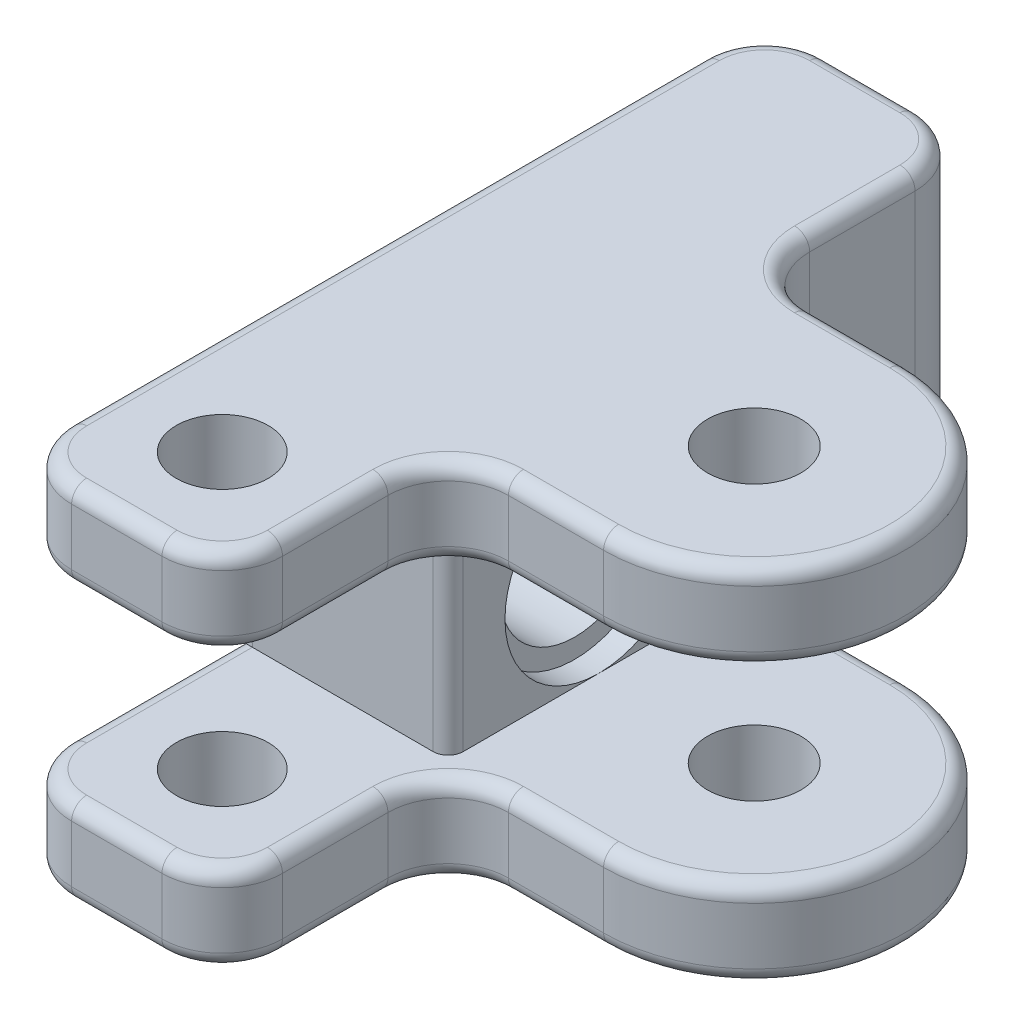
from build123d import *

# Parameters (mm, degrees)
SKETCH2_R           = 1.55
SKETCH2_R_2         = 1.525
BOSS_EXTRUDE1_DEPTH = 12
SKETCH3_W           = 11.91431853
SKETCH3_H           = 6.23
CUT_EXTRUDE1_DEPTH  = 12
FILLET2_R           = 2
SKETCH5_R           = 2.475
CUT_EXTRUDE3_DEPTH  = 13
SKETCH6_W           = 7
SKETCH6_H           = 6.23
CUT_EXTRUDE4_DEPTH  = 7.5
FILLET3_R           = 2
CUT_EXTRUDE5_START  = -0.8
SKETCH8_R           = 3.115
SKETCH8_R_2         = 2.475
CUT_EXTRUDE5_DEPTH  = 0.8
FILLET8_R           = 0.5


with BuildPart() as part:
    # Sketch2 → Boss-Extrude1 (new body)
    with BuildSketch(Plane(origin=(0, 0, 0), x_dir=(1, 0, 0), z_dir=(0, 1, 0))):
        with BuildLine():
            Line((-5.16, -5), (-5.16, -12.5))
            Line((-5.16, -12.5), (-12.16, -12.5))
            Line((-12.16, -12.5), (-12.16, 12.5))
            Line((-12.16, 12.5), (-5.16, 12.5))
            Line((-5.16, 12.5), (-5.16, 5))
            Line((-5.16, 5), (0, 5))
            ThreePointArc((0, 5), (5, 0), (0, -5))
            Line((0, -5), (-5.16, -5))
        make_face()
        with Locations(Location((0, 0, 0), (0, 0, 270))):
            Circle(SKETCH2_R, mode=Mode.SUBTRACT)
        with Locations(Location((-8.66, -9, 0), (0, 0, 270))):
            Circle(SKETCH2_R_2, mode=Mode.SUBTRACT)
    extrude(amount=BOSS_EXTRUDE1_DEPTH)

    # Sketch3 → Cut-Extrude1 (cut)
    with BuildSketch(Plane.XY.offset(5)):
        with Locations((0.797159265, 6)):
            Rectangle(SKETCH3_W, SKETCH3_H)
    extrude(amount=-CUT_EXTRUDE1_DEPTH, mode=Mode.SUBTRACT)

    # Fillet2
    fillet2_edges = [part.edges().sort_by_distance(p)[0] for p in [
        (-5.16, 10.5575, 5),
        (-5.16, 10.5575, -5),
        (-5.16, 1.4425, 5),
        (-5.16, 1.4425, -5),
    ]]
    fillet(fillet2_edges, radius=FILLET2_R)

    # Sketch5 → Cut-Extrude3 (cut)
    with BuildSketch(Plane.ZY.offset(12.16)):
        with Locations((0, 6)):
            Circle(SKETCH5_R)
    extrude(amount=-CUT_EXTRUDE3_DEPTH, mode=Mode.SUBTRACT)

    # Sketch6 → Cut-Extrude4 (cut)
    with BuildSketch(Plane.XY.offset(12.5)):
        with Locations((-8.66, 6)):
            Rectangle(SKETCH6_W, SKETCH6_H)
    extrude(amount=-CUT_EXTRUDE4_DEPTH, mode=Mode.SUBTRACT)

    # Fillet3
    fillet3_edges = [part.edges().sort_by_distance(p)[0] for p in [
        (-5.16, 1.4425, 12.5),
        (-12.16, 1.4425, 12.5),
        (-5.16, 10.5575, 12.5),
        (-12.16, 10.5575, 12.5),
        (-12.16, 6, -12.5),
        (-5.16, 6, -12.5),
    ]]
    fillet(fillet3_edges, radius=FILLET3_R)

    # Sketch8 → Cut-Extrude5 (cut)
    with BuildSketch(Plane(origin=(-5.16, 0, 0), x_dir=(0, 0, -1), z_dir=(1, 0, 0)).offset(CUT_EXTRUDE5_START)):
        with Locations((0, 6)):
            Circle(SKETCH8_R)
        with Locations(Location((0, 6, 0), (0, 0, 180))):
            Circle(SKETCH8_R_2, mode=Mode.SUBTRACT)
    extrude(amount=CUT_EXTRUDE5_DEPTH, mode=Mode.SUBTRACT)

    # Fillet8
    # the kernel refuses this fillet: 0.5 mm, written as the material it takes off along each edge
    with BuildSketch(Plane(origin=(-3.16, 0, -5), x_dir=(0, 0, 1), z_dir=(1, 0, 0)), Plane(origin=(-3.16, 2.885, -5), x_dir=(0, -1, 0), z_dir=(1, 0, 0)), Plane(origin=(0, 2.885, 5), x_dir=(0, -1, 0), z_dir=(-1, 0, 0)), Plane(origin=(0, 0, 5), x_dir=(0, 0, -1), z_dir=(-1, 0, 0))) as fillet8_piece_1:
        with BuildLine():
            CenterArc((FILLET8_R, -FILLET8_R), FILLET8_R, 90, 90)
            Line((0, -FILLET8_R), (0, 0))
            Line((0, 0), (FILLET8_R, 0))
        make_face()
    extrude(amount=3.16, mode=Mode.SUBTRACT)
    with BuildSketch(Plane(origin=(0, 0, 0), x_dir=(0, 0, -1), z_dir=(-1, 0, 0))) as fillet8_piece_2:
        with BuildLine():
            CenterArc((5 - FILLET8_R, -FILLET8_R), FILLET8_R, 0, 90)
            Line((5, -FILLET8_R), (5, 0))
            Line((5, 0), (5 - FILLET8_R, 0))
        make_face()
    revolve(axis=Axis((0, 0, 0), (0, -1, 0)), revolution_arc=180, mode=Mode.SUBTRACT)
    with BuildSketch(Plane(origin=(-12.16, 2.885, 5), x_dir=(0, 0, -1), z_dir=(0, 1, 0))) as fillet8_piece_3:
        with BuildLine():
            CenterArc((FILLET8_R, -FILLET8_R), FILLET8_R, 90, 90)
            Line((0, -FILLET8_R), (0, 0))
            Line((0, 0), (FILLET8_R, 0))
        make_face()
    extrude(amount=6.23, mode=Mode.SUBTRACT)
    with BuildSketch(Plane(origin=(-12.16, 2.885, 10.5), x_dir=(0, -1, 0), z_dir=(0, 0, -1))) as fillet8_piece_4:
        with BuildLine():
            CenterArc((FILLET8_R, -FILLET8_R), FILLET8_R, 90, 90)
            Line((0, -FILLET8_R), (0, 0))
            Line((0, 0), (FILLET8_R, 0))
        make_face()
    extrude(amount=5.5, mode=Mode.SUBTRACT)
    with BuildSketch(Plane(origin=(-12.16, 9.115, 10.5), x_dir=(0, 1, 0), z_dir=(0, 0, -1))) as fillet8_piece_5:
        with BuildLine():
            CenterArc((FILLET8_R, FILLET8_R), FILLET8_R, 180, 90)
            Line((0, FILLET8_R), (0, 0))
            Line((0, 0), (FILLET8_R, 0))
        make_face()
    extrude(amount=5.5, mode=Mode.SUBTRACT)
    with BuildSketch(Plane(origin=(-5.16, 9.115, 5), x_dir=(-1, 0, 0), z_dir=(0, -1, 0))) as fillet8_piece_6:
        with BuildLine():
            CenterArc((FILLET8_R, FILLET8_R), FILLET8_R, 180, 90)
            Line((0, FILLET8_R), (0, 0))
            Line((0, 0), (FILLET8_R, 0))
        make_face()
    extrude(amount=6.23, mode=Mode.SUBTRACT)
    with BuildSketch(Plane(origin=(-5.16, 9.115, 10.5), x_dir=(-1, 0, 0), z_dir=(0, 0, -1)), Plane(origin=(-5.16, 2.885, 10.5), x_dir=(0, -1, 0), z_dir=(0, 0, -1)), Plane(origin=(-5.16, 12, 7), x_dir=(-1, 0, 0), z_dir=(0, 0, 1))) as fillet8_piece_7:
        with BuildLine():
            CenterArc((FILLET8_R, FILLET8_R), FILLET8_R, 180, 90)
            Line((0, FILLET8_R), (0, 0))
            Line((0, 0), (FILLET8_R, 0))
        make_face()
    extrude(amount=3.5, mode=Mode.SUBTRACT)
    with BuildSketch(Plane(origin=(-12.16, 12, 10.5), x_dir=(0, -1, 0), z_dir=(0, 0, -1)), Plane(origin=(-12.16, 0, 10.5), x_dir=(1, 0, 0), z_dir=(0, 0, -1))) as fillet8_piece_8:
        with BuildLine():
            CenterArc((FILLET8_R, -FILLET8_R), FILLET8_R, 90, 90)
            Line((0, -FILLET8_R), (0, 0))
            Line((0, 0), (FILLET8_R, 0))
        make_face()
    extrude(amount=21, mode=Mode.SUBTRACT)
    with BuildSketch(Plane(origin=(-5.16, 0, 7), x_dir=(-1, 0, 0), z_dir=(0, 0, 1)), Plane(origin=(-5.16, 0, -10.5), x_dir=(-1, 0, 0), z_dir=(0, 0, 1)), Plane(origin=(-5.16, 12, -10.5), x_dir=(0, -1, 0), z_dir=(0, 0, 1))) as fillet8_piece_9:
        with BuildLine():
            CenterArc((FILLET8_R, -FILLET8_R), FILLET8_R, 90, 90)
            Line((0, -FILLET8_R), (0, 0))
            Line((0, 0), (FILLET8_R, 0))
        make_face()
    extrude(amount=3.5, mode=Mode.SUBTRACT)
    with BuildSketch(Plane(origin=(-7.16, 0, 12.5), x_dir=(0, 0, -1), z_dir=(-1, 0, 0)), Plane(origin=(-10.16, 0, -12.5), x_dir=(0, 0, 1), z_dir=(1, 0, 0)), Plane(origin=(-10.16, 12, -12.5), x_dir=(0, -1, 0), z_dir=(1, 0, 0)), Plane(origin=(-7.16, 2.885, 12.5), x_dir=(0, -1, 0), z_dir=(-1, 0, 0))) as fillet8_piece_10:
        with BuildLine():
            CenterArc((FILLET8_R, -FILLET8_R), FILLET8_R, 90, 90)
            Line((0, -FILLET8_R), (0, 0))
            Line((0, 0), (FILLET8_R, 0))
        make_face()
    extrude(amount=3, mode=Mode.SUBTRACT)
    with BuildSketch(Plane(origin=(-10.16, 0, 10.5), x_dir=(0, 0, 1), z_dir=(1, 0, 0))) as fillet8_piece_11:
        with BuildLine():
            CenterArc((2 - FILLET8_R, -FILLET8_R), FILLET8_R, 0, 90)
            Line((2, -FILLET8_R), (2, 0))
            Line((2, 0), (2 - FILLET8_R, 0))
        make_face()
    revolve(axis=Axis((-10.16, 0, 10.5), (0, -1, 0)), revolution_arc=90, mode=Mode.SUBTRACT)
    with BuildSketch(Plane(origin=(-7.16, 0, 10.5), x_dir=(1, 0, 0), z_dir=(0, 0, -1))) as fillet8_piece_12:
        with BuildLine():
            CenterArc((2 - FILLET8_R, -FILLET8_R), FILLET8_R, 0, 90)
            Line((2, -FILLET8_R), (2, 0))
            Line((2, 0), (2 - FILLET8_R, 0))
        make_face()
    revolve(axis=Axis((-7.16, 0, 10.5), (0, -1, 0)), revolution_arc=90, mode=Mode.SUBTRACT)
    with BuildSketch(Plane(origin=(-7.16, 0, -10.5), x_dir=(1, 0, 0), z_dir=(0, 0, 1))) as fillet8_piece_13:
        with BuildLine():
            CenterArc((2 - FILLET8_R, FILLET8_R), FILLET8_R, 270, 90)
            Line((2, FILLET8_R), (2, 0))
            Line((2, 0), (2 - FILLET8_R, 0))
        make_face()
    revolve(axis=Axis((-7.16, 0, -10.5), (0, 1, 0)), revolution_arc=90, mode=Mode.SUBTRACT)
    with BuildSketch(Plane(origin=(-10.16, 0, -10.5), x_dir=(-1, 0, 0), z_dir=(0, 0, 1))) as fillet8_piece_14:
        with BuildLine():
            CenterArc((2 - FILLET8_R, -FILLET8_R), FILLET8_R, 0, 90)
            Line((2, -FILLET8_R), (2, 0))
            Line((2, 0), (2 - FILLET8_R, 0))
        make_face()
    revolve(axis=Axis((-10.16, 0, -10.5), (0, -1, 0)), revolution_arc=90, mode=Mode.SUBTRACT)
    with BuildSketch(Plane(origin=(-7.16, 12, 12.5), x_dir=(0, 0, -1), z_dir=(-1, 0, 0)), Plane(origin=(-10.16, 9.115, 12.5), x_dir=(0, 0, -1), z_dir=(1, 0, 0))) as fillet8_piece_15:
        with BuildLine():
            CenterArc((FILLET8_R, FILLET8_R), FILLET8_R, 180, 90)
            Line((0, FILLET8_R), (0, 0))
            Line((0, 0), (FILLET8_R, 0))
        make_face()
    extrude(amount=3, mode=Mode.SUBTRACT)
    with BuildSketch(Plane(origin=(-7.16, 12, 10.5), x_dir=(0, 0, 1), z_dir=(-1, 0, 0))) as fillet8_piece_16:
        with BuildLine():
            CenterArc((2 - FILLET8_R, -FILLET8_R), FILLET8_R, 0, 90)
            Line((2, -FILLET8_R), (2, 0))
            Line((2, 0), (2 - FILLET8_R, 0))
        make_face()
    revolve(axis=Axis((-7.16, 12, 10.5), (0, 1, 0)), revolution_arc=90, mode=Mode.SUBTRACT)
    with BuildSketch(Plane(origin=(-10.16, 12, 10.5), x_dir=(-1, 0, 0), z_dir=(0, 0, -1))) as fillet8_piece_17:
        with BuildLine():
            CenterArc((2 - FILLET8_R, -FILLET8_R), FILLET8_R, 0, 90)
            Line((2, -FILLET8_R), (2, 0))
            Line((2, 0), (2 - FILLET8_R, 0))
        make_face()
    revolve(axis=Axis((-10.16, 12, 10.5), (0, 1, 0)), revolution_arc=90, mode=Mode.SUBTRACT)
    with BuildSketch(Plane(origin=(-7.16, 12, -10.5), x_dir=(1, 0, 0), z_dir=(0, 0, 1))) as fillet8_piece_18:
        with BuildLine():
            CenterArc((2 - FILLET8_R, -FILLET8_R), FILLET8_R, 0, 90)
            Line((2 - FILLET8_R, 0), (2, 0))
            Line((2, 0), (2, -FILLET8_R))
        make_face()
    revolve(axis=Axis((-7.16, 12, -10.5), (0, 1, 0)), revolution_arc=90, mode=Mode.SUBTRACT)
    with BuildSketch(Plane(origin=(-10.16, 12, -10.5), x_dir=(-1, 0, 0), z_dir=(0, 0, 1))) as fillet8_piece_19:
        with BuildLine():
            CenterArc((2 - FILLET8_R, FILLET8_R), FILLET8_R, 270, 90)
            Line((2 - FILLET8_R, 0), (2, 0))
            Line((2, 0), (2, FILLET8_R))
        make_face()
    revolve(axis=Axis((-10.16, 12, -10.5), (0, -1, 0)), revolution_arc=90, mode=Mode.SUBTRACT)
    with BuildSketch(Plane(origin=(-7.16, 9.115, 10.5), x_dir=(0, 0, 1), z_dir=(-1, 0, 0))) as fillet8_piece_20:
        with BuildLine():
            CenterArc((2 - FILLET8_R, FILLET8_R), FILLET8_R, 270, 90)
            Line((2, FILLET8_R), (2, 0))
            Line((2, 0), (2 - FILLET8_R, 0))
        make_face()
    revolve(axis=Axis((-7.16, 9.115, 10.5), (0, 1, 0)), revolution_arc=90, mode=Mode.SUBTRACT)
    with BuildSketch(Plane(origin=(-10.16, 9.115, 10.5), x_dir=(-1, 0, 0), z_dir=(0, 0, -1))) as fillet8_piece_21:
        with BuildLine():
            CenterArc((2 - FILLET8_R, FILLET8_R), FILLET8_R, 270, 90)
            Line((2 - FILLET8_R, 0), (2, 0))
            Line((2, 0), (2, FILLET8_R))
        make_face()
    revolve(axis=Axis((-10.16, 9.115, 10.5), (0, 1, 0)), revolution_arc=90, mode=Mode.SUBTRACT)
    with BuildSketch(Plane(origin=(-10.16, 2.885, 10.5), x_dir=(0, 0, 1), z_dir=(1, 0, 0))) as fillet8_piece_22:
        with BuildLine():
            CenterArc((2 - FILLET8_R, FILLET8_R), FILLET8_R, 270, 90)
            Line((2 - FILLET8_R, 0), (2, 0))
            Line((2, 0), (2, FILLET8_R))
        make_face()
    revolve(axis=Axis((-10.16, 2.885, 10.5), (0, -1, 0)), revolution_arc=90, mode=Mode.SUBTRACT)
    with BuildSketch(Plane(origin=(-7.16, 2.885, 10.5), x_dir=(1, 0, 0), z_dir=(0, 0, -1))) as fillet8_piece_23:
        with BuildLine():
            CenterArc((2 - FILLET8_R, FILLET8_R), FILLET8_R, 270, 90)
            Line((2 - FILLET8_R, 0), (2, 0))
            Line((2, 0), (2, FILLET8_R))
        make_face()
    revolve(axis=Axis((-7.16, 2.885, 10.5), (0, -1, 0)), revolution_arc=90, mode=Mode.SUBTRACT)
    with BuildSketch(Plane(origin=(0, 2.885, 0), x_dir=(0, 0, -1), z_dir=(-1, 0, 0))) as fillet8_piece_24:
        with BuildLine():
            CenterArc((5 - FILLET8_R, FILLET8_R), FILLET8_R, 270, 90)
            Line((5 - FILLET8_R, 0), (5, 0))
            Line((5, 0), (5, FILLET8_R))
        make_face()
    revolve(axis=Axis((0, 2.885, 0), (0, -1, 0)), revolution_arc=180, mode=Mode.SUBTRACT)
    with BuildSketch(Plane(origin=(0, 9.115, 0), x_dir=(0, 0, -1), z_dir=(-1, 0, 0))) as fillet8_piece_25:
        with BuildLine():
            CenterArc((5 - FILLET8_R, -FILLET8_R), FILLET8_R, 0, 90)
            Line((5, -FILLET8_R), (5, 0))
            Line((5, 0), (5 - FILLET8_R, 0))
        make_face()
    revolve(axis=Axis((0, 9.115, 0), (0, -1, 0)), revolution_arc=180, mode=Mode.SUBTRACT)
    with BuildSketch(Plane(origin=(0, 9.115, -5), x_dir=(0, 0, 1), z_dir=(-1, 0, 0)), Plane(origin=(-3.16, 9.115, 5), x_dir=(0, 0, -1), z_dir=(1, 0, 0)), Plane(origin=(0, 12, 5), x_dir=(0, 0, -1), z_dir=(-1, 0, 0)), Plane(origin=(-3.16, 12, -5), x_dir=(0, 0, 1), z_dir=(1, 0, 0))) as fillet8_piece_26:
        with BuildLine():
            CenterArc((FILLET8_R, FILLET8_R), FILLET8_R, 180, 90)
            Line((0, FILLET8_R), (0, 0))
            Line((0, 0), (FILLET8_R, 0))
        make_face()
    extrude(amount=3.16, mode=Mode.SUBTRACT)
    with BuildSketch(Plane(origin=(0, 12, 0), x_dir=(0, 0, -1), z_dir=(-1, 0, 0))) as fillet8_piece_27:
        with BuildLine():
            CenterArc((5 - FILLET8_R, FILLET8_R), FILLET8_R, 270, 90)
            Line((5, FILLET8_R), (5, 0))
            Line((5, 0), (5 - FILLET8_R, 0))
        make_face()
    revolve(axis=Axis((0, 12, 0), (0, -1, 0)), revolution_arc=180, mode=Mode.SUBTRACT)
    with BuildSketch(Plane(origin=(-3.16, 9.115, -7), x_dir=(-0.48631676857152506, 0, -0.87378258199975), z_dir=(0.87378258199975, 0, -0.48631676857152506))) as fillet8_piece_28_section:
        with BuildLine():
            CenterArc((2 + FILLET8_R, FILLET8_R), FILLET8_R, 180, 90)
            Line((2, FILLET8_R), (2, 0))
            Line((2, 0), (2 + FILLET8_R, 0))
        make_face()
    fillet8_piece_28 = revolve(axis=Axis((-3.16, 9.115, -7), (0, 1, 0)), revolution_arc=150.901220426, mode=Mode.PRIVATE)
    fillet8_piece_28 = split(fillet8_piece_28, bisect_by=Plane(origin=(-5.16, 9.115, -7), z_dir=(1, 0, 0)), keep=Keep.TOP, mode=Mode.PRIVATE)
    add(fillet8_piece_28, mode=Mode.SUBTRACT)
    with BuildSketch(Plane(origin=(-3.16, 12, -7), x_dir=(-1, 0, 0), z_dir=(0, 0, -1))) as fillet8_piece_29:
        with BuildLine():
            CenterArc((2 + FILLET8_R, -FILLET8_R), FILLET8_R, 90, 90)
            Line((2, -FILLET8_R), (2, 0))
            Line((2, 0), (2 + FILLET8_R, 0))
        make_face()
    revolve(axis=Axis((-3.16, 12, -7), (0, 1, 0)), revolution_arc=90, mode=Mode.SUBTRACT)
    with BuildSketch(Plane(origin=(-3.16, 0, -7), x_dir=(-1, 0, 0), z_dir=(0, 0, -1))) as fillet8_piece_30:
        with BuildLine():
            CenterArc((2 + FILLET8_R, FILLET8_R), FILLET8_R, 180, 90)
            Line((2, FILLET8_R), (2, 0))
            Line((2, 0), (2 + FILLET8_R, 0))
        make_face()
    revolve(axis=Axis((-3.16, 0, -7), (0, 1, 0)), revolution_arc=90, mode=Mode.SUBTRACT)
    with BuildSketch(Plane(origin=(-3.16, 2.885, -7), x_dir=(-0.48631676857152506, 0, -0.87378258199975), z_dir=(0.87378258199975, 0, -0.48631676857152506))) as fillet8_piece_31_section:
        with BuildLine():
            CenterArc((2 + FILLET8_R, -FILLET8_R), FILLET8_R, 90, 90)
            Line((2 + FILLET8_R, 0), (2, 0))
            Line((2, 0), (2, -FILLET8_R))
        make_face()
    fillet8_piece_31 = revolve(axis=Axis((-3.16, 2.885, -7), (0, 1, 0)), revolution_arc=150.901220426, mode=Mode.PRIVATE)
    fillet8_piece_31 = split(fillet8_piece_31, bisect_by=Plane(origin=(-5.16, 2.885, -7), z_dir=(1, 0, 0)), keep=Keep.TOP, mode=Mode.PRIVATE)
    add(fillet8_piece_31, mode=Mode.SUBTRACT)
    with BuildSketch(Plane(origin=(-3.16, 9.115, 7), x_dir=(-1, 0, 0), z_dir=(0, 0, 1))) as fillet8_piece_32:
        with BuildLine():
            CenterArc((2 + FILLET8_R, -FILLET8_R), FILLET8_R, 90, 90)
            Line((2, -FILLET8_R), (2, 0))
            Line((2, 0), (2 + FILLET8_R, 0))
        make_face()
    revolve(axis=Axis((-3.16, 9.115, 7), (0, -1, 0)), revolution_arc=90, mode=Mode.SUBTRACT)
    with BuildSketch(Plane(origin=(-3.16, 12, 7), x_dir=(-1, 0, 0), z_dir=(0, 0, 1))) as fillet8_piece_33:
        with BuildLine():
            CenterArc((2 + FILLET8_R, FILLET8_R), FILLET8_R, 180, 90)
            Line((2, FILLET8_R), (2, 0))
            Line((2, 0), (2 + FILLET8_R, 0))
        make_face()
    revolve(axis=Axis((-3.16, 12, 7), (0, -1, 0)), revolution_arc=90, mode=Mode.SUBTRACT)
    with BuildSketch(Plane(origin=(-3.16, 0, 7), x_dir=(0, 0, -1), z_dir=(1, 0, 0))) as fillet8_piece_34:
        with BuildLine():
            CenterArc((2 + FILLET8_R, FILLET8_R), FILLET8_R, 180, 90)
            Line((2, FILLET8_R), (2, 0))
            Line((2, 0), (2 + FILLET8_R, 0))
        make_face()
    revolve(axis=Axis((-3.16, 0, 7), (0, 1, 0)), revolution_arc=90, mode=Mode.SUBTRACT)
    with BuildSketch(Plane(origin=(-3.16, 2.885, 7), x_dir=(0, 0, -1), z_dir=(1, 0, 0))) as fillet8_piece_35:
        with BuildLine():
            CenterArc((2 + FILLET8_R, -FILLET8_R), FILLET8_R, 90, 90)
            Line((2 + FILLET8_R, 0), (2, 0))
            Line((2, 0), (2, -FILLET8_R))
        make_face()
    revolve(axis=Axis((-3.16, 2.885, 7), (0, 1, 0)), revolution_arc=90, mode=Mode.SUBTRACT)
    with BuildSketch(Plane(origin=(-12.16, 2.885, 10.5), x_dir=(0, -1, 0), z_dir=(0, 0, -1))) as fillet8_piece_36a_section:
        with BuildLine():
            CenterArc((FILLET8_R, -FILLET8_R), FILLET8_R, 90, 90)
            Line((0, -FILLET8_R), (0, 0))
            Line((0, 0), (FILLET8_R, 0))
        make_face()
    fillet8_piece_36a = extrude(amount=6.75, mode=Mode.PRIVATE)
    fillet8_piece_36a = split(fillet8_piece_36a, bisect_by=Plane(origin=(-12.16, 2.885, 5), z_dir=(0, 0, -1)), keep=Keep.TOP, mode=Mode.PRIVATE)
    with BuildSketch(Plane(origin=(-12.16, 1.635, 5), x_dir=(0, 0, -1), z_dir=(0, 1, 0))) as fillet8_piece_36b_section:
        with BuildLine():
            CenterArc((FILLET8_R, -FILLET8_R), FILLET8_R, 90, 90)
            Line((0, -FILLET8_R), (0, 0))
            Line((0, 0), (FILLET8_R, 0))
        make_face()
    fillet8_piece_36b = extrude(amount=7.48, mode=Mode.PRIVATE)
    fillet8_piece_36b = split(fillet8_piece_36b, bisect_by=Plane(origin=(-12.16, 2.885, 5), z_dir=(0, -1, 0)), keep=Keep.TOP, mode=Mode.PRIVATE)
    fillet8_piece_36 = fillet8_piece_36a & fillet8_piece_36b
    add(fillet8_piece_36, mode=Mode.SUBTRACT)
    with BuildSketch(Plane(origin=(-12.16, 2.885, 5), x_dir=(0, 0, -1), z_dir=(0, 1, 0))) as fillet8_piece_37a_section:
        with BuildLine():
            CenterArc((FILLET8_R, -FILLET8_R), FILLET8_R, 90, 90)
            Line((0, -FILLET8_R), (0, 0))
            Line((0, 0), (FILLET8_R, 0))
        make_face()
    fillet8_piece_37a = extrude(amount=7.48, mode=Mode.PRIVATE)
    fillet8_piece_37a = split(fillet8_piece_37a, bisect_by=Plane(origin=(-12.16, 9.115, 5), z_dir=(0, 1, 0)), keep=Keep.TOP, mode=Mode.PRIVATE)
    with BuildSketch(Plane(origin=(-12.16, 9.115, 10.5), x_dir=(0, 1, 0), z_dir=(0, 0, -1))) as fillet8_piece_37b_section:
        with BuildLine():
            CenterArc((FILLET8_R, FILLET8_R), FILLET8_R, 180, 90)
            Line((0, FILLET8_R), (0, 0))
            Line((0, 0), (FILLET8_R, 0))
        make_face()
    fillet8_piece_37b = extrude(amount=6.75, mode=Mode.PRIVATE)
    fillet8_piece_37b = split(fillet8_piece_37b, bisect_by=Plane(origin=(-12.16, 9.115, 5), z_dir=(0, 0, -1)), keep=Keep.TOP, mode=Mode.PRIVATE)
    fillet8_piece_37 = fillet8_piece_37a & fillet8_piece_37b
    add(fillet8_piece_37, mode=Mode.SUBTRACT)


solid = part.part
